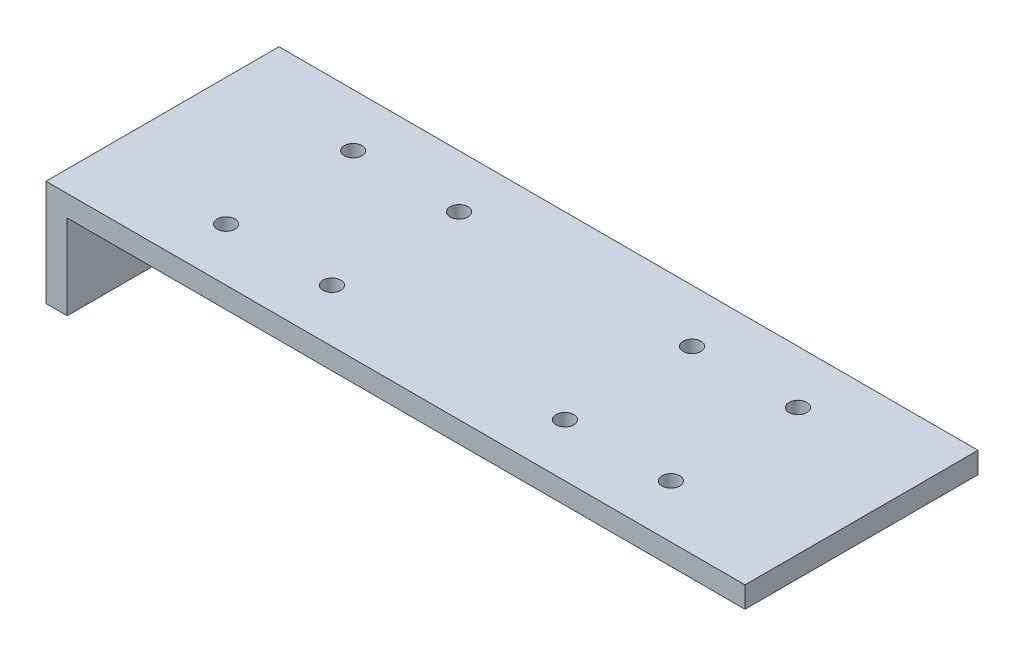
from build123d import *

# Parameters (mm, degrees)
SKETCH_1_W          = 85
SKETCH_1_H          = 55
EXTRUDE_1_DEPTH     = 5
SKETCH_2_W          = 5
SKETCH_2_H          = 55
EXTRUDE_2_DEPTH     = 20
SKETCH_3_W          = 55
SKETCH_3_H          = 5
EXTRUDE_3_DEPTH     = 80
SKETCH_7_R          = 2.1
CUT_EXTRUDE_1_DEPTH = 5


with BuildPart() as part:
    # 草图1 → 凸台-拉伸1 (new body)
    with BuildSketch(Plane(origin=(0, 0, 0), x_dir=(1, 0, 0), z_dir=(0, 1, 0))):
        Rectangle(SKETCH_1_W, SKETCH_1_H)
    extrude(amount=EXTRUDE_1_DEPTH)

    # 草图2 → 凸台-拉伸2 (add)
    with BuildSketch(Plane.XZ):
        with Locations((-40, 0)):
            Rectangle(SKETCH_2_W, SKETCH_2_H)
    extrude(amount=EXTRUDE_2_DEPTH)

    # 草图3 → 凸台-拉伸3 (add)
    with BuildSketch(Plane(origin=(42.5, 0, 0), x_dir=(0, 0, -1), z_dir=(1, 0, 0))):
        with Locations((0, 2.5)):
            Rectangle(SKETCH_3_W, SKETCH_3_H)
    extrude(amount=EXTRUDE_3_DEPTH)

    # 草图7 → 切除-拉伸1 (cut)
    with BuildSketch(Plane(origin=(0, 5, 0), x_dir=(1, 0, 0), z_dir=(0, 1, 0))):
        with Locations((-12.5, 15)):
            Circle(SKETCH_7_R)
        with Locations((12.5, 15)):
            Circle(SKETCH_7_R)
        with Locations((67.5, 15)):
            Circle(SKETCH_7_R)
        with Locations((92.5, 15)):
            Circle(SKETCH_7_R)
        with Locations((92.5, -15)):
            Circle(SKETCH_7_R)
        with Locations((67.5, -15)):
            Circle(SKETCH_7_R)
        with Locations((12.5, -15)):
            Circle(SKETCH_7_R)
        with Locations((-12.5, -15)):
            Circle(SKETCH_7_R)
    extrude(amount=-CUT_EXTRUDE_1_DEPTH, mode=Mode.SUBTRACT)


solid = part.part
